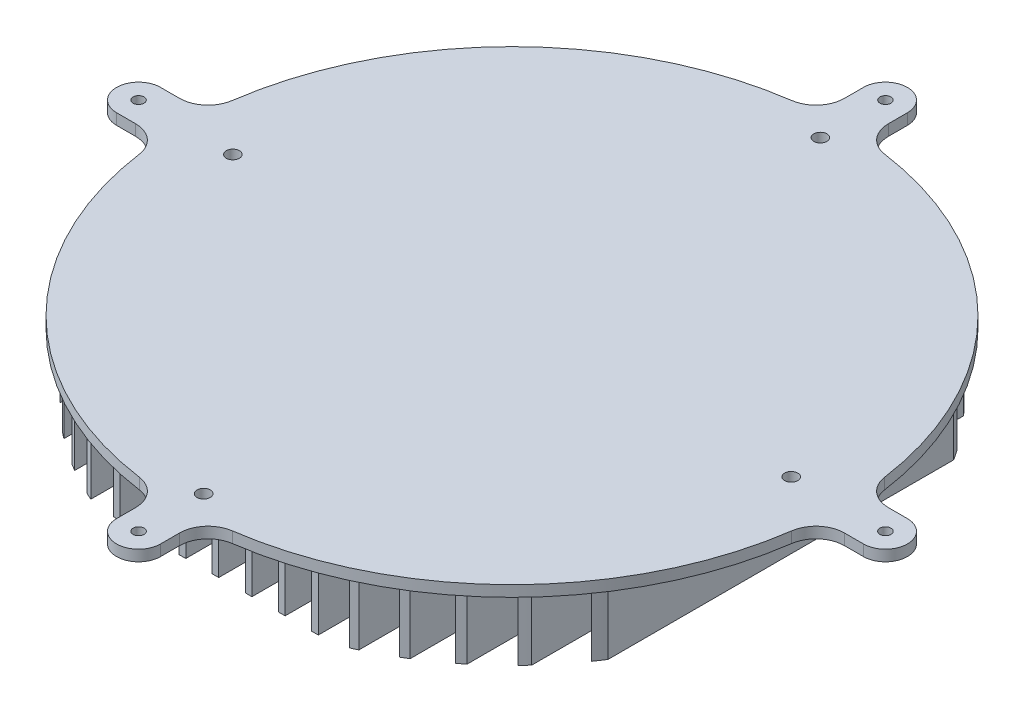
from build123d import *

# Parameters (mm, degrees)
SKETCH3_R           = 2.5
BOSS_EXTRUDE4_DEPTH = 5
SKETCH4_W           = 3
SKETCH4_H           = 270
BOSS_EXTRUDE5_DEPTH = 30
SKETCH7_R           = 3
CUT_EXTRUDE1_DEPTH  = 10


with BuildPart() as part:
    # Sketch3 → Boss-Extrude4 (new body)
    with BuildSketch(Plane(origin=(0, 0, 0), x_dir=(1, 0, 0), z_dir=(0, 1, 0))):
        with BuildLine():
            Line((161.369142032, 10), (170, 10))
            ThreePointArc((170, 10), (180, 0), (170, -10))
            Line((170, -10), (161.369142032, -10))
            ThreePointArc((161.369142032, -10), (152.849946816, -13.180462695), (148.499210458, -21.165644172))
            ThreePointArc((148.499210458, -21.165644172), (106.066017178, -106.066017178), (21.165644172, -148.499210458))
            ThreePointArc((21.165644172, -148.499210458), (13.180462695, -152.849946816), (10, -161.369142032))
            Line((10, -161.369142032), (10, -170))
            ThreePointArc((10, -170), (0, -180), (-10, -170))
            Line((-10, -170), (-10, -161.369142032))
            ThreePointArc((-10, -161.369142032), (-13.180462695, -152.849946816), (-21.165644172, -148.499210458))
            ThreePointArc((-21.165644172, -148.499210458), (-106.066017178, -106.066017178), (-148.499210458, -21.165644172))
            ThreePointArc((-148.499210458, -21.165644172), (-152.849946816, -13.180462695), (-161.369142032, -10))
            Line((-161.369142032, -10), (-170, -10))
            ThreePointArc((-170, -10), (-180, 0), (-170, 10))
            Line((-170, 10), (-161.369142032, 10))
            ThreePointArc((-161.369142032, 10), (-152.849946816, 13.180462695), (-148.499210458, 21.165644172))
            ThreePointArc((-148.499210458, 21.165644172), (-106.066017178, 106.066017178), (-21.165644172, 148.499210458))
            ThreePointArc((-21.165644172, 148.499210458), (-13.180462695, 152.849946816), (-10, 161.369142032))
            Line((-10, 161.369142032), (-10, 170))
            ThreePointArc((-10, 170), (0, 180), (10, 170))
            Line((10, 170), (10, 161.369142032))
            ThreePointArc((10, 161.369142032), (13.180462695, 152.849946816), (21.165644172, 148.499210458))
            ThreePointArc((21.165644172, 148.499210458), (106.066017178, 106.066017178), (148.499210458, 21.165644172))
            ThreePointArc((148.499210458, 21.165644172), (152.849946816, 13.180462695), (161.369142032, 10))
        make_face()
        with Locations((0, 170)):
            Circle(SKETCH3_R, mode=Mode.SUBTRACT)
        with Locations((170, 0)):
            Circle(SKETCH3_R, mode=Mode.SUBTRACT)
        with Locations((0, -170)):
            Circle(SKETCH3_R, mode=Mode.SUBTRACT)
        with Locations((-170, 0)):
            Circle(SKETCH3_R, mode=Mode.SUBTRACT)
    extrude(amount=-BOSS_EXTRUDE4_DEPTH)

    # Sketch4 → Boss-Extrude5 (add)
    with BuildSketch(Plane.XZ.offset(5)):
        Rectangle(SKETCH4_W, SKETCH4_H)
        with Locations((15.111111111, 0)):
            Rectangle(SKETCH4_W, SKETCH4_H)
        with Locations((30.222222222, 0)):
            Rectangle(SKETCH4_W, SKETCH4_H)
        with Locations((45.333333333, 0)):
            Rectangle(SKETCH4_W, SKETCH4_H)
        with BuildLine():
            Line((58.944444444, -133.025570734), (58.944444444, 133.025570734))
            ThreePointArc((58.944444444, 133.025570734), (60.448326928, 132.348969666), (61.944444444, 131.655367541))
            Line((61.944444444, 131.655367541), (61.944444444, -131.655367541))
            ThreePointArc((61.944444444, -131.655367541), (60.448326928, -132.348969666), (58.944444444, -133.025570734))
        make_face()
        with BuildLine():
            Line((74.055555556, -125.243860893), (74.055555556, 125.243860893))
            ThreePointArc((74.055555556, 125.243860893), (75.561053939, 124.341373354), (77.055555556, 123.420789813))
            Line((77.055555556, 123.420789813), (77.055555556, -123.420789813))
            ThreePointArc((77.055555556, -123.420789813), (75.561053939, -124.341373354), (74.055555556, -125.243860893))
        make_face()
        with BuildLine():
            Line((89.166666667, -114.976326066), (89.166666667, 114.976326066))
            ThreePointArc((89.166666667, 114.976326066), (90.674545129, 113.790934901), (92.166666667, 112.585769774))
            Line((92.166666667, 112.585769774), (92.166666667, -112.585769774))
            ThreePointArc((92.166666667, -112.585769774), (90.674545129, -113.790934901), (89.166666667, -114.976326066))
        make_face()
        with BuildLine():
            Line((104.277777778, -101.471153841), (104.277777778, 101.471153841))
            ThreePointArc((104.277777778, 101.471153841), (105.78970509, 99.893885183), (107.277777778, 98.294091354))
            Line((107.277777778, 98.294091354), (107.277777778, -98.294091354))
            ThreePointArc((107.277777778, -98.294091354), (105.78970509, -99.893885183), (104.277777778, -101.471153841))
        make_face()
        with BuildLine():
            Line((119.388888889, -83.165757436), (119.388888889, 83.165757436))
            ThreePointArc((119.388888889, 83.165757436), (120.909654093, 80.938900086), (122.388888889, 78.684241602))
            Line((122.388888889, 78.684241602), (122.388888889, -78.684241602))
            ThreePointArc((122.388888889, -78.684241602), (120.909654093, -80.938900086), (119.388888889, -83.165757436))
        make_face()
        with Locations((-15, 0)):
            Rectangle(SKETCH4_W, SKETCH4_H)
        with Locations((-30, 0)):
            Rectangle(SKETCH4_W, SKETCH4_H)
        with Locations((-45, 0)):
            Rectangle(SKETCH4_W, SKETCH4_H)
        with BuildLine():
            Line((-58.5, -133.221619867), (-58.5, 133.221619867))
            ThreePointArc((-58.5, 133.221619867), (-60.003842191, 132.551080427), (-61.5, 131.863565855))
            Line((-61.5, 131.863565855), (-61.5, -131.863565855))
            ThreePointArc((-61.5, -131.863565855), (-60.003842191, -132.551080427), (-58.5, -133.221619867))
        make_face()
        with BuildLine():
            Line((-73.5, -125.570697219), (-73.5, 125.570697219))
            ThreePointArc((-73.5, 125.570697219), (-75.005428577, 124.677326263), (-76.5, 123.765908068))
            Line((-76.5, 123.765908068), (-76.5, -123.765908068))
            ThreePointArc((-76.5, -123.765908068), (-75.005428577, -124.677326263), (-73.5, -125.570697219))
        make_face()
        with BuildLine():
            Line((-88.5, -115.49025933), (-88.5, 115.49025933))
            ThreePointArc((-88.5, 115.49025933), (-90.007748427, 114.319093869), (-91.5, 113.12824581))
            Line((-91.5, 113.12824581), (-91.5, -113.12824581))
            ThreePointArc((-91.5, -113.12824581), (-90.007748427, -114.319093869), (-88.5, -115.49025933))
        make_face()
        with BuildLine():
            Line((-103.5, -102.264363294), (-103.5, 102.264363294))
            ThreePointArc((-103.5, 102.264363294), (-105.011648126, 100.711487715), (-106.5, 99.136269851))
            Line((-106.5, 99.136269851), (-106.5, -99.136269851))
            ThreePointArc((-106.5, -99.136269851), (-105.011648126, -100.711487715), (-103.5, -102.264363294))
        make_face()
        with BuildLine():
            Line((-118.5, -84.427483677), (-118.5, 84.427483677))
            ThreePointArc((-118.5, 84.427483677), (-120.019959278, 82.252412579), (-121.5, 80.049984385))
            Line((-121.5, 80.049984385), (-121.5, -80.049984385))
            ThreePointArc((-121.5, -80.049984385), (-120.019959278, -82.252412579), (-118.5, -84.427483677))
        make_face()
    extrude(amount=BOSS_EXTRUDE5_DEPTH)

    # Sketch7 → Cut-Extrude1 (cut)
    with BuildSketch(Plane(origin=(0, 0, 0), x_dir=(1, 0, 0), z_dir=(0, 1, 0))):
        with Locations((-127.088241501, 0)):
            Circle(SKETCH7_R)
        with Locations((0, 140.377871213)):
            Circle(SKETCH7_R)
        with Locations((0, -140.377871213)):
            Circle(SKETCH7_R)
        with Locations((127.088241501, 0)):
            Circle(SKETCH7_R)
    extrude(amount=-CUT_EXTRUDE1_DEPTH, mode=Mode.SUBTRACT)


solid = part.part
